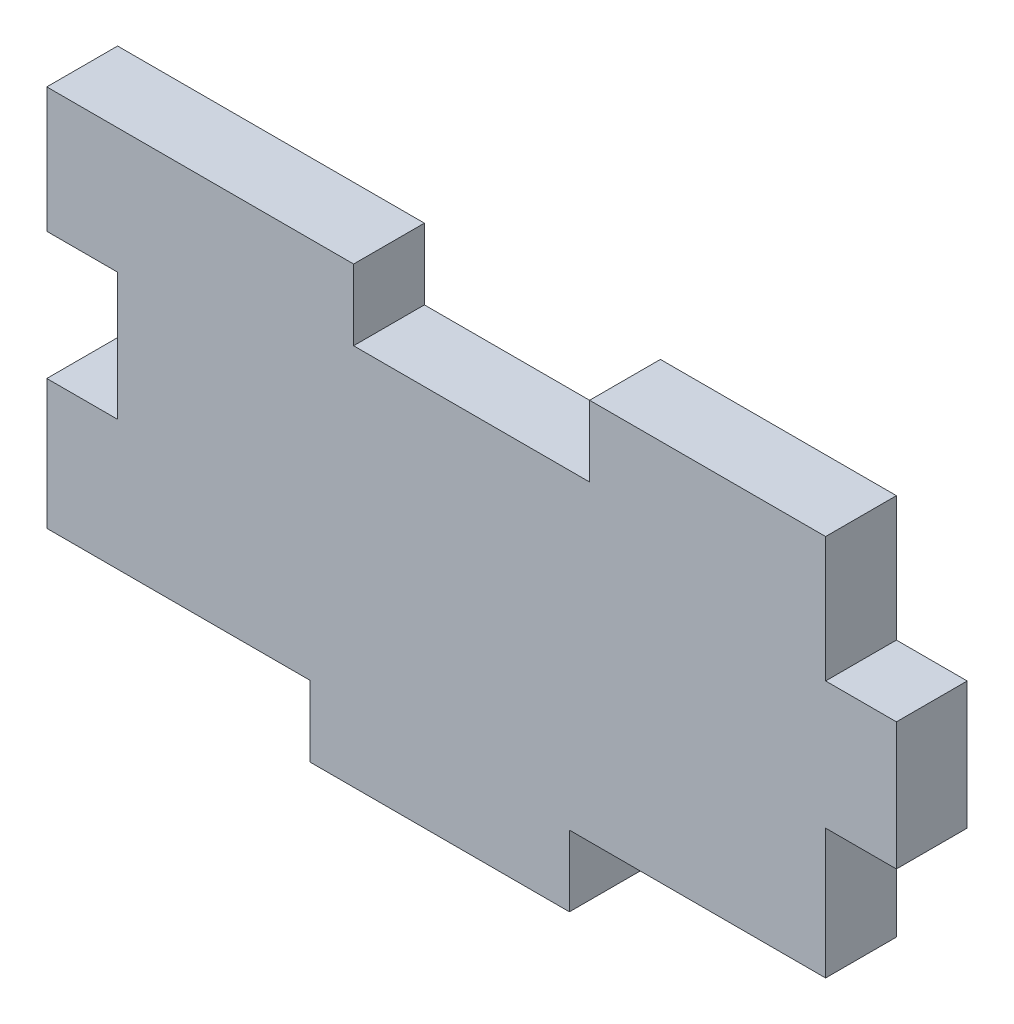
from build123d import *

# Parameters (mm, degrees)
BOSS_EXTRUDE1_DEPTH = 5
CAVITY1_START       = 8.5
CAVITY1_OUTLINE_W   = 16.666666666
CAVITY1_OUTLINE_H   = 5
CAVITY1_DEPTH       = 5


# Read off the part's stored shape, not the designer's step: Cavity1
with BuildPart() as part:
    # Sketch1 → Boss-Extrude1 (new body)
    with BuildSketch(Plane.XY):
        Polygon((27.5, 4.666666667), (27.5, 13.5), (-27.5, 13.5), (-27.5, 4.666666667), (-22.5, 4.666666667), (-22.5, -4.333333333), (-27.5, -4.333333333), (-27.5, -13.5), (-8.924137908, -13.5), (-8.924137908, -18.5), (9.409195426, -18.5), (9.409195426, -13.5), (27.5, -13.5), (27.5, -4.333333333), (32.5, -4.333333333), (32.5, 4.666666667), align=None)
    extrude(amount=BOSS_EXTRUDE1_DEPTH)

    # Cavity1 outline → Cavity1 (cut)
    with BuildSketch(Plane(origin=(0, 0, 0), x_dir=(1, 0, 0), z_dir=(0, 1, 0)).offset(CAVITY1_START)):
        with Locations((2.5, -2.5)):
            Rectangle(CAVITY1_OUTLINE_W, CAVITY1_OUTLINE_H)
    extrude(amount=CAVITY1_DEPTH, mode=Mode.SUBTRACT)


solid = part.part
